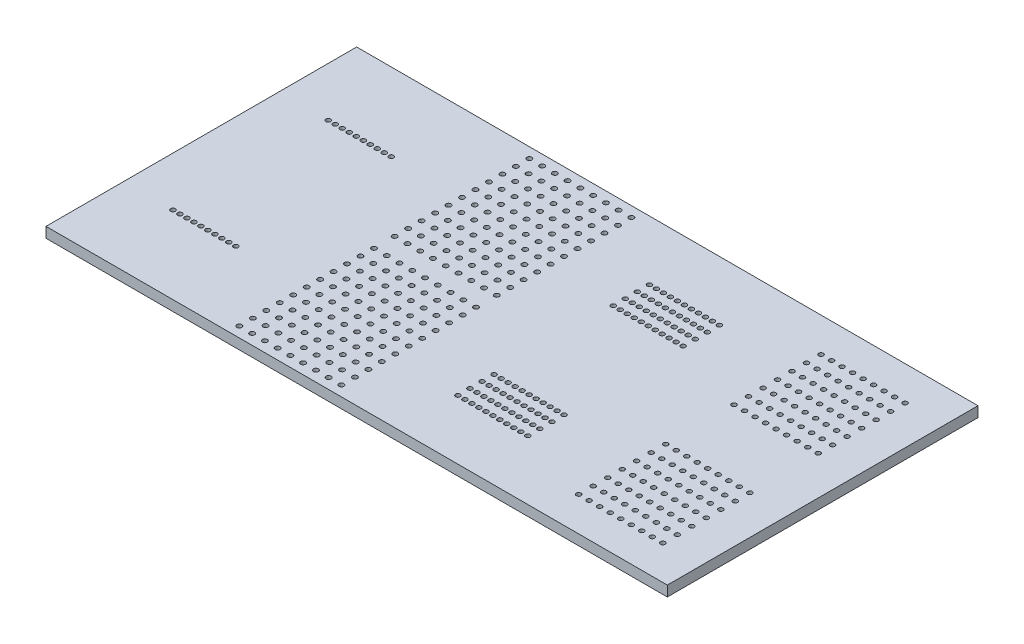
from build123d import *

# Parameters (mm, degrees)
ESQUISSE2_W                     = 120
ESQUISSE2_H                     = 30
BOSS_EXTRU_1_DEPTH              = 2
ENL_V_MAT_EXTRU_3_REACH         = 63.879
ESQUISSE8_R                     = 0.45
R_P_TITION_LIN_AIRE4_COUNT      = 10
R_P_TITION_LIN_AIRE4_PITCH      = 1.35
ENL_V_MAT_EXTRU_4_REACH         = 63.879
ESQUISSE10_R                    = 0.475
R_P_TITION_LIN_AIRE5_COUNT      = 9
R_P_TITION_LIN_AIRE5_PITCH      = 2.464
R_P_TITION_LIN_AIRE5_COUNT_DIR2 = 11
R_P_TITION_LIN_AIRE5_PITCH_DIR2 = 2.6
ENL_V_MAT_EXTRU_5_REACH         = 63.879
ESQUISSE12_R                    = 0.45
R_P_TITION_LIN_AIRE6_COUNT      = 11
R_P_TITION_LIN_AIRE6_PITCH      = 1.35
R_P_TITION_LIN_AIRE6_COUNT_DIR2 = 4
R_P_TITION_LIN_AIRE6_PITCH_DIR2 = 2.333
ENL_V_MAT_EXTRU_6_REACH         = 63.879
ESQUISSE14_R                    = 0.45
R_P_TITION_LIN_AIRE7_COUNT      = 9
R_P_TITION_LIN_AIRE7_PITCH      = 2.03
R_P_TITION_LIN_AIRE7_COUNT_DIR2 = 7
R_P_TITION_LIN_AIRE7_PITCH_DIR2 = 2.8


with BuildPart() as part:
    # Esquisse2 → Boss.-Extru.1 (new body)
    with BuildSketch(Plane(origin=(0, 0, 0), x_dir=(1, 0, 0), z_dir=(0, 1, 0))):
        Rectangle(ESQUISSE2_W, ESQUISSE2_H)
    extrude(amount=BOSS_EXTRU_1_DEPTH)

    # Esquisse8 → Enlèv. mat.-Extru.3 (cut, up to next)
    with BuildSketch(Plane(origin=(0, 2, 0), x_dir=(1, 0, 0), z_dir=(0, 1, 0)), mode=Mode.PRIVATE) as enl_v_mat_extru_3_sk1:
        with Locations((-50.475, 0)):
            Circle(ESQUISSE8_R)
    enl_v_mat_extru_3_tool1 = extrude(enl_v_mat_extru_3_sk1.sketch, amount=-ENL_V_MAT_EXTRU_3_REACH, mode=Mode.PRIVATE) & part.part
    enl_v_mat_extru_3 = enl_v_mat_extru_3_tool1.solids().sort_by_distance((-50.475, 2, 0))[0]
    add(enl_v_mat_extru_3, mode=Mode.SUBTRACT)

    # Répétition linéaire4: Enlèv. mat.-Extru.3 ×10
    with Locations(*[(i * R_P_TITION_LIN_AIRE4_PITCH, 0, 0) for i in range(1, R_P_TITION_LIN_AIRE4_COUNT)]):
        add(enl_v_mat_extru_3, mode=Mode.SUBTRACT)

    # Esquisse10 → Enlèv. mat.-Extru.4 (cut, up to next)
    with BuildSketch(Plane(origin=(0, 2, 0), x_dir=(1, 0, 0), z_dir=(0, 1, 0)), mode=Mode.PRIVATE) as enl_v_mat_extru_4_sk1:
        with Locations((-24.656, 13)):
            Circle(ESQUISSE10_R)
    enl_v_mat_extru_4_tool1 = extrude(enl_v_mat_extru_4_sk1.sketch, amount=-ENL_V_MAT_EXTRU_4_REACH, mode=Mode.PRIVATE) & part.part
    enl_v_mat_extru_4 = enl_v_mat_extru_4_tool1.solids().sort_by_distance((-24.656, 2, -13))[0]
    add(enl_v_mat_extru_4, mode=Mode.SUBTRACT)

    # Répétition linéaire5: Enl_v. mat.-Extru.4 9 × 11
    with Locations(*[(i * R_P_TITION_LIN_AIRE5_PITCH, 0, j * R_P_TITION_LIN_AIRE5_PITCH_DIR2) for i in range(R_P_TITION_LIN_AIRE5_COUNT) for j in range(R_P_TITION_LIN_AIRE5_COUNT_DIR2) if (i, j) != (0, 0)]):
        add(enl_v_mat_extru_4, mode=Mode.SUBTRACT)

    # Esquisse12 → Enlèv. mat.-Extru.5 (cut, up to next)
    with BuildSketch(Plane(origin=(0, 2, 0), x_dir=(1, 0, 0), z_dir=(0, 1, 0)), mode=Mode.PRIVATE) as enl_v_mat_extru_5_sk1:
        with Locations((8.05, 3.4995)):
            Circle(ESQUISSE12_R)
    enl_v_mat_extru_5_tool1 = extrude(enl_v_mat_extru_5_sk1.sketch, amount=-ENL_V_MAT_EXTRU_5_REACH, mode=Mode.PRIVATE) & part.part
    enl_v_mat_extru_5 = enl_v_mat_extru_5_tool1.solids().sort_by_distance((8.05, 2, -3.4995))[0]
    add(enl_v_mat_extru_5, mode=Mode.SUBTRACT)

    # Répétition linéaire6: Enl_v. mat.-Extru.5 11 × 4
    with Locations(*[(i * R_P_TITION_LIN_AIRE6_PITCH, 0, j * R_P_TITION_LIN_AIRE6_PITCH_DIR2) for i in range(R_P_TITION_LIN_AIRE6_COUNT) for j in range(R_P_TITION_LIN_AIRE6_COUNT_DIR2) if (i, j) != (0, 0)]):
        add(enl_v_mat_extru_5, mode=Mode.SUBTRACT)

    # Esquisse14 → Enlèv. mat.-Extru.6 (cut, up to next)
    with BuildSketch(Plane(origin=(0, 2, 0), x_dir=(1, 0, 0), z_dir=(0, 1, 0)), mode=Mode.PRIVATE) as enl_v_mat_extru_6_sk1:
        with Locations((36.28, 8.4)):
            Circle(ESQUISSE14_R)
    enl_v_mat_extru_6_tool1 = extrude(enl_v_mat_extru_6_sk1.sketch, amount=-ENL_V_MAT_EXTRU_6_REACH, mode=Mode.PRIVATE) & part.part
    enl_v_mat_extru_6 = enl_v_mat_extru_6_tool1.solids().sort_by_distance((36.28, 2, -8.4))[0]
    add(enl_v_mat_extru_6, mode=Mode.SUBTRACT)

    # Répétition linéaire7: Enl_v. mat.-Extru.6 9 × 7
    with Locations(*[(i * R_P_TITION_LIN_AIRE7_PITCH, 0, j * R_P_TITION_LIN_AIRE7_PITCH_DIR2) for i in range(R_P_TITION_LIN_AIRE7_COUNT) for j in range(R_P_TITION_LIN_AIRE7_COUNT_DIR2) if (i, j) != (0, 0)]):
        add(enl_v_mat_extru_6, mode=Mode.SUBTRACT)

    # Symétrie1: part across plane


with BuildPart() as part_1:
    add(part.part)
    add(part.part.mirror(Plane(origin=(-60, 2, 15), x_dir=(1, 0, 0), z_dir=(0, 0, -1))))


solid = part_1.part
